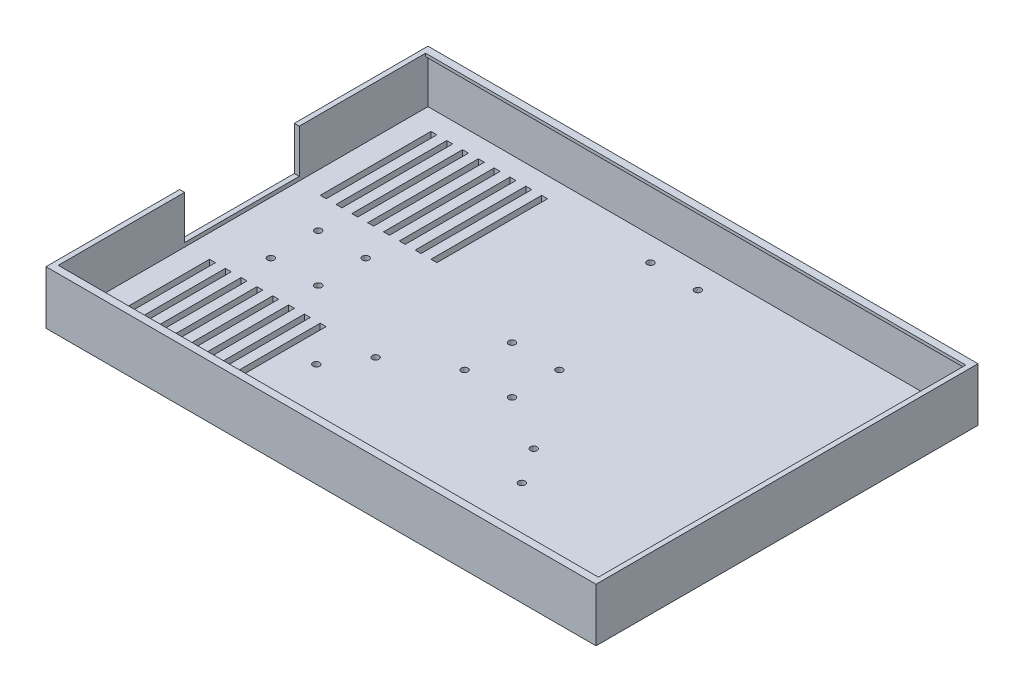
from build123d import *

# Parameters (mm, degrees)
SKETCH1_W                     = 278.2
SKETCH1_H                     = 193.2
SHELL_BLOCK_DEPTH             = 27
SKETCH2_W                     = 273.2
SKETCH2_H                     = 185.8
FRONT_OPENING_DEPTH           = 1.5
SKETCH3_W                     = 273.2
SKETCH3_H                     = 188.2
DISPLAY_POCKET_DEPTH          = 22.5
SKETCH4_W                     = 3
SKETCH4_H                     = 56
VENT_SLOTS_DEPTH              = 4
SKETCH5_W                     = 58
SKETCH5_H                     = 23
CABLE_EXIT_X_SHORT_SIDE_DEPTH = 140.1
SKETCH6_R                     = 1.7
BOLT_HOLES_DEPTH              = 4


with BuildPart() as part:
    # Sketch1 → Shell Block (new body)
    with BuildSketch(Plane(origin=(0, 0, 0), x_dir=(1, 0, 0), z_dir=(0, 1, 0))):
        Rectangle(SKETCH1_W, SKETCH1_H)
    extrude(amount=SHELL_BLOCK_DEPTH)

    # Sketch2 → Front Opening (cut)
    with BuildSketch(Plane(origin=(0, 27, 0), x_dir=(1, 0, 0), z_dir=(0, 1, 0))):
        Rectangle(SKETCH2_W, SKETCH2_H)
    extrude(amount=-FRONT_OPENING_DEPTH, mode=Mode.SUBTRACT)

    # Sketch3 → Display Pocket (cut)
    with BuildSketch(Plane(origin=(0, 25.5, 0), x_dir=(1, 0, 0), z_dir=(0, 1, 0))):
        Rectangle(SKETCH3_W, SKETCH3_H)
    extrude(amount=-DISPLAY_POCKET_DEPTH, mode=Mode.SUBTRACT)

    # Sketch4 → Vent Slots (cut)
    with BuildSketch(Plane(origin=(0, 3, 0), x_dir=(1, 0, 0), z_dir=(0, 1, 0))):
        with Locations((-67.5, 56)):
            Rectangle(SKETCH4_W, SKETCH4_H)
        with Locations((-67.5, -56)):
            Rectangle(SKETCH4_W, SKETCH4_H)
        with Locations((-75.5, 56)):
            Rectangle(SKETCH4_W, SKETCH4_H)
        with Locations((-75.5, -56)):
            Rectangle(SKETCH4_W, SKETCH4_H)
        with Locations((-83.5, 56)):
            Rectangle(SKETCH4_W, SKETCH4_H)
        with Locations((-83.5, -56)):
            Rectangle(SKETCH4_W, SKETCH4_H)
        with Locations((-91.5, 56)):
            Rectangle(SKETCH4_W, SKETCH4_H)
        with Locations((-91.5, -56)):
            Rectangle(SKETCH4_W, SKETCH4_H)
        with Locations((-99.5, 56)):
            Rectangle(SKETCH4_W, SKETCH4_H)
        with Locations((-99.5, -56)):
            Rectangle(SKETCH4_W, SKETCH4_H)
        with Locations((-107.5, 56)):
            Rectangle(SKETCH4_W, SKETCH4_H)
        with Locations((-107.5, -56)):
            Rectangle(SKETCH4_W, SKETCH4_H)
        with Locations((-115.5, 56)):
            Rectangle(SKETCH4_W, SKETCH4_H)
        with Locations((-115.5, -56)):
            Rectangle(SKETCH4_W, SKETCH4_H)
        with Locations((-123.5, 56)):
            Rectangle(SKETCH4_W, SKETCH4_H)
        with Locations((-123.5, -56)):
            Rectangle(SKETCH4_W, SKETCH4_H)
    extrude(amount=-VENT_SLOTS_DEPTH, mode=Mode.SUBTRACT)

    # Sketch5 → Cable Exit (-X short side) (cut)
    with BuildSketch(Plane(origin=(0, 0, 0), x_dir=(0, 0, -1), z_dir=(1, 0, 0))):
        with Locations((0, 16.5)):
            Rectangle(SKETCH5_W, SKETCH5_H)
    extrude(amount=-CABLE_EXIT_X_SHORT_SIDE_DEPTH, mode=Mode.SUBTRACT)

    # Sketch6 → Bolt Holes (cut)
    with BuildSketch(Plane(origin=(0, 3, 0), x_dir=(1, 0, 0), z_dir=(0, 1, 0))):
        with Locations((-40, -29)):
            Circle(SKETCH6_R)
        with Locations((-40, -89)):
            Circle(SKETCH6_R)
        with Locations((40, -29)):
            Circle(SKETCH6_R)
        with Locations((40, -89)):
            Circle(SKETCH6_R)
        with Locations((-52, -47)):
            Circle(SKETCH6_R)
        with Locations((-52, -71)):
            Circle(SKETCH6_R)
        with Locations((52, -47)):
            Circle(SKETCH6_R)
        with Locations((52, -71)):
            Circle(SKETCH6_R)
        with Locations((-12, 82)):
            Circle(SKETCH6_R)
        with Locations((12, 82)):
            Circle(SKETCH6_R)
        with Locations((124, 12)):
            Circle(SKETCH6_R)
        with Locations((124, -12)):
            Circle(SKETCH6_R)
        with Locations((-12, 12)):
            Circle(SKETCH6_R)
        with Locations((-12, -12)):
            Circle(SKETCH6_R)
        with Locations((12, 12)):
            Circle(SKETCH6_R)
        with Locations((12, -12)):
            Circle(SKETCH6_R)
        with Locations((-110, -12)):
            Circle(SKETCH6_R)
        with Locations((-110, 12)):
            Circle(SKETCH6_R)
        with Locations((-86, -12)):
            Circle(SKETCH6_R)
        with Locations((-86, 12)):
            Circle(SKETCH6_R)
    extrude(amount=-BOLT_HOLES_DEPTH, mode=Mode.SUBTRACT)


solid = part.part
